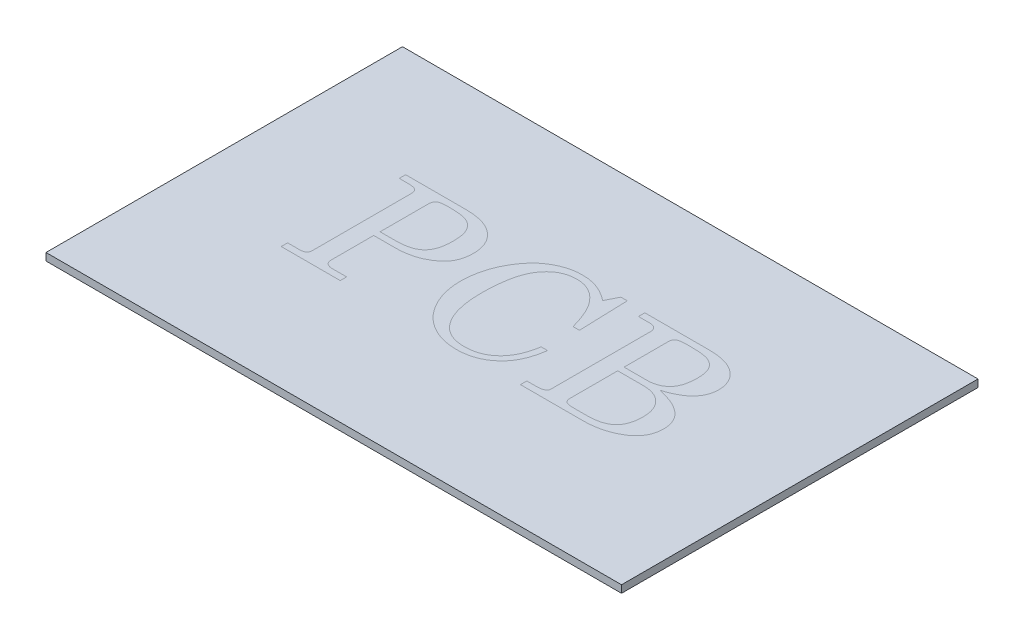
from build123d import *

# Parameters (mm, degrees)
SKETCH1_W           = 155
SKETCH1_H           = 96
BOSS_EXTRUDE1_DEPTH = 2


with BuildPart() as part:
    # Sketch1 → Boss-Extrude1 (new body)
    with BuildSketch(Plane(origin=(0, 0, 0), x_dir=(1, 0, 0), z_dir=(0, 1, 0))):
        Rectangle(SKETCH1_W, SKETCH1_H)
    extrude(amount=BOSS_EXTRUDE1_DEPTH)


solid = part.part
